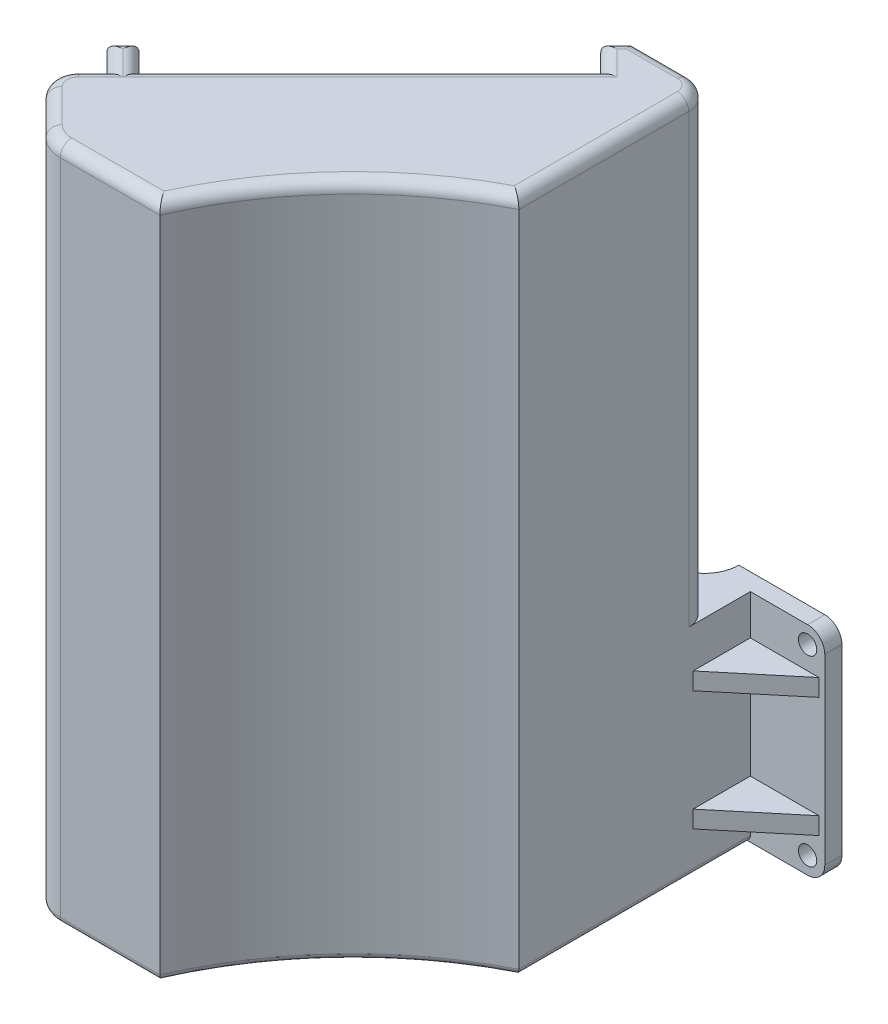
from build123d import *

# Parameters (mm, degrees)
SKETCH_2_R                                   = 1.5000000000000047
SKETCH_2_R_2                                 = 6
SKETCH_2_R_3                                 = 5.999999999999896
SKETCH_2_R_4                                 = 2.5000000000000044
SKETCH_2_R_5                                 = 6.0000000000000036
SKETCH_2_R_6                                 = 1.499999999999982
SKETCH_2_R_7                                 = 2.5000000000000475
SKETCH_2_R_8                                 = 5.999999999999912
SKETCH_2_R_9                                 = 6.000000000000018
SKETCH_2_R_10                                = 1.4999999999999887
SKETCH_2_R_11                                = 64.99999999999996
SKETCH_2_R_12                                = 2.5000000000000226
SKETCH_2_R_13                                = 5.999999999999982
SKETCH_2_R_14                                = 1.500000000000318
SKETCH_2_R_15                                = 2.500000000000045
SKETCH_2_R_16                                = 2.499999999999998
EXTRUDE_1_DEPTH                              = 3
CUT_EXTRUDE_1_DEPTH                          = 10
SKETCH_4_W                                   = 371.78166000996697
SKETCH_4_H                                   = 92.77079077614133
CUT_EXTRUDE_2_DEPTH                          = 10
CUT_EXTRUDE_3_DEPTH                          = 10
CUT_EXTRUDE_4_DEPTH                          = 10
MIRROR_3_COPY_1_DEPTH                        = 10
MIRROR_3_COPY_2_DEPTH                        = 10
SKETCH_13_R                                  = 1.4999999999999973
SKETCH_13_R_2                                = 1.5000000000000242
SKETCH_13_R_3                                = 1.499999999999971
CUT_EXTRUDE_7_DEPTH                          = 10
MIRROR_4_AT_THE_SECOND_PLANE_COPY_1_SKET_R   = 1.4999999999999973
MIRROR_4_AT_THE_SECOND_PLANE_COPY_1_SKET_R_2 = 1.5000000000000242
MIRROR_4_AT_THE_SECOND_PLANE_COPY_1_SKET_R_3 = 1.499999999999971
MIRROR_4_AT_THE_SECOND_PLANE_COPY_1_DEPTH    = 10
CUT_EXTRUDE_8_DEPTH                          = 10
FILLET_1_R                                   = 10
CUT_EXTRUDE_9_DEPTH                          = 10
FILLET_3_R                                   = 3
MIRROR_START                                 = -3
MIRROR_7_DEPTH                               = 3
FILLET_4_R                                   = 10
SKETCH_27_R                                  = 6.000000000000017
SKETCH_27_R_2                                = 6.00000000000001
EXTRUDE_2_DEPTH                              = 3
CUT_EXTRUDE_10_DEPTH                         = 3
MIRROR_11_COPY_1_DEPTH                       = 3
FILLET_5_R                                   = 8
SKETCH_30_R                                  = 4.999999999999998
CUT_EXTRUDE_11_DEPTH                         = 3
CUT_EXTRUDE_12_DEPTH                         = 3
FILLET_6_R                                   = 3
CUT_EXTRUDE_13_DEPTH                         = 3
FILLET_7_R                                   = 5
CUT_EXTRUDE_15_DEPTH                         = 10
PATTERN_CIRCULAR_1_COUNT                     = 6
CUT_EXTRUDE_16_DEPTH                         = 3
FILLET_8_R                                   = 8
SKETCH_35_R                                  = 1.6000000000000383
SKETCH_35_R_2                                = 1.6000000000000316
SKETCH_35_R_3                                = 1.549999999999985
SKETCH_35_R_4                                = 1.5499999999999818
CUT_EXTRUDE_17_DEPTH                         = 3
EXTRUDE_6_DEPTH                              = 37.9
EXTRUDE_7_DEPTH                              = 80
CUT_EXTRUDE_18_DEPTH                         = 75
SKETCH_49_W                                  = 56.99999999999994
SKETCH_49_H                                  = 2
CUT_EXTRUDE_24_DEPTH                         = 6
CUT_EXTRUDE_25_DEPTH                         = 77
CUT_EXTRUDE_26_DEPTH                         = 659.0034997067874
EXTRUDE_8_DEPTH                              = 1
EXTRUDE_9_DEPTH                              = 1
SKETCH_54_W                                  = 12.999999999999993
SKETCH_54_H                                  = 3
EXTRUDE_10_DEPTH                             = 37.9
SKETCH_55_R                                  = 1.5999999999999999
SKETCH_55_R_2                                = 1.6
SKETCH_55_R_3                                = 1.5999999999999974
SKETCH_55_R_4                                = 1.599999999999998
CUT_EXTRUDE_27_DEPTH                         = 3
CHAMFER_1_SIZE                               = 6
SKETCH_56_W                                  = 56.99999999999994
SKETCH_56_H                                  = 1.8999999999999986
CUT_EXTRUDE_28_DEPTH                         = 6
CUT_EXTRUDE_29_REACH                         = 643.105
RIB_24_DEPTH                                 = 3
RIB_25_DEPTH                                 = 3
SKETCH_62_W                                  = 19.88274623538981
SKETCH_62_H                                  = 7
CUT_EXTRUDE_30_DEPTH                         = 642.1048869249186
SKETCH_64_R                                  = 1.6000000000014152
SKETCH_64_R_2                                = 1.6000000000000214
SKETCH_64_R_3                                = 1.600000000005825
SKETCH_64_R_4                                = 1.6000000000029233
CUT_EXTRUDE_31_DEPTH                         = 10
FILLET_9_R                                   = 2
FILLET_10_R                                  = 1
FILLET_11_R                                  = 3
FILLET_12_R                                  = 4
FILLET_13_R                                  = 6
CUT_EXTRUDE_32_DEPTH                         = 629.3057907872907
CUT_EXTRUDE_33_DEPTH                         = 629.0418590638866


# Read off the part's stored shape, not the designer's step: 镜向7, 凸台-拉伸6, 分割2, 筋24, 筋25
# Some blends are built 0.0001 mm under size
with BuildPart() as part:
    # 草图2 → 凸台-拉伸1 (new body)
    with BuildSketch(Plane(origin=(0, 0, 0), x_dir=(1, 0, 0), z_dir=(0, 1, 0))):
        with BuildLine():
            Line((27.570452121331073, -570.9456738076426), (-65.28417146522384, -616.4870712236112))
            ThreePointArc((-65.28417146522382, -616.4870712236112), (-70.18356660465001, -620.9131675574213), (-72, -627.2609995659623))
            Line((-72, -627.2609995659623), (-71.9999999999999, -702.2609995659624))
            ThreePointArc((-72.00000000000003, -702.2609995659624), (-71.12457285451967, -706.7603193817217), (-68.62602019925255, -710.6031680803289))
            Line((-68.62602019925225, -710.6031680803286), (-4.16166117727812, -777.2609995659623))
            Line((-4.16166117727812, -777.2609995659623), (18.010224019904005, -777.2609995659623))
            ThreePointArc((18.010224019904005, -777.2609995659623), (25.57479680504481, -774.5764296997943), (29.75476556528185, -767.7238726623467))
            Line((29.75476556528182, -767.7238726623467), (35.41694496312394, -740.7230088042123))
            ThreePointArc((35.41694496312393, -740.7230088042123), (39.11913002337672, -734.3395076023972), (45.85666051961371, -731.3293673023098))
            Line((45.85666051961371, -731.3293673023098), (59.62894300052795, -729.8413226083014))
            ThreePointArc((59.62894300052794, -729.8413226083014), (64.99999999999996, -729.5520030171261), (70.37105699947203, -729.8413226083003))
            Line((70.37105699947203, -729.8413226083003), (84.14333948038299, -731.3293673023052))
            ThreePointArc((84.14333948038299, -731.3293673023052), (90.88747654966255, -734.3454566177528), (94.586801163437, -740.7403903132582))
            Line((94.58680116343702, -740.7403903132582), (100.24523443471817, -767.7238726623467))
            ThreePointArc((100.24523443471813, -767.7238726623467), (104.42520319495517, -774.5764296997943), (111.98977598009597, -777.2609995659623))
            Line((111.98977598009598, -777.2609995659623), (134.16166117727812, -777.2609995659619))
            Line((134.16166117727812, -777.2609995659619), (198.6260201992523, -710.6031680803287))
            ThreePointArc((198.62602019925245, -710.6031680803288), (201.12457285451964, -706.7603193817217), (202.00000000000003, -702.2609995659623))
            Line((201.99999999999997, -702.2609995659623), (202, -627.2609995659622))
            ThreePointArc((202, -627.2609995659622), (200.18356660465003, -620.9131675574212), (195.28417146522386, -616.4870712236111))
            Line((195.28417146522384, -616.4870712236112), (102.42954787866894, -570.9456738076426))
            ThreePointArc((102.42954787866887, -570.9456738076428), (65.00000000000001, -562.2609995659624), (27.57045212133115, -570.9456738076427))
        make_face()
        with Locations(Location((-54.25000000000036, -712.220291709485, 0), (0, 0, 270))):
            Circle(SKETCH_2_R, mode=Mode.SUBTRACT)
        with Locations(Location((24.797056938561603, -748.8766871478217, 0), (0, 0, 270))):
            Circle(SKETCH_2_R_2, mode=Mode.SUBTRACT)
        with BuildLine():
            Line((20.591308188858598, -731.9896561446249), (20.591308188858626, -725.8641802360004))
            ThreePointArc((20.59130818885863, -725.8641802360004), (22.09130818885864, -724.3641802360004), (23.59130818885865, -725.8641802360004))
            Line((23.591308188858655, -725.8641802360004), (23.59130818885863, -731.9896561446249))
            ThreePointArc((23.591308188858623, -731.9896561446249), (22.091308188858612, -733.4896561446249), (20.5913081888586, -731.9896561446249))
        make_face(mode=Mode.SUBTRACT)
        with Locations(Location((-59.99999999999989, -702.2609995659623, 0), (0, 0, 270))):
            Circle(SKETCH_2_R_3, mode=Mode.SUBTRACT)
        with Locations(Location((-0.08180909439592376, -684.8359995659603, 0), (0, 0, 270))):
            Circle(SKETCH_2_R_4, mode=Mode.SUBTRACT)
        with Locations(Location((105.20294306143838, -748.8766871478217, 0), (0, 0, 270))):
            Circle(SKETCH_2_R_5, mode=Mode.SUBTRACT)
        with BuildLine():
            ThreePointArc((64.99999999999959, -724.910999565959), (62.50000000000184, -722.410999565959), (64.99999999999959, -719.910999565959))
            ThreePointArc((64.99999999999959, -719.910999565959), (67.50000000000183, -722.410999565959), (64.99999999999959, -724.910999565959))
        make_face(mode=Mode.SUBTRACT)
        with BuildLine():
            ThreePointArc((106.4086918111405, -725.8641802360006), (107.90869181114051, -724.3641802360006), (109.40869181114053, -725.8641802360006))
            Line((109.40869181114053, -725.8641802360006), (109.40869181114053, -731.9896561446251))
            ThreePointArc((109.40869181114053, -731.9896561446251), (107.90869181114051, -733.4896561446251), (106.4086918111405, -731.9896561446251))
            Line((106.4086918111405, -731.9896561446251), (106.4086918111405, -725.8641802360006))
        make_face(mode=Mode.SUBTRACT)
        with Locations(Location((184.25000000000006, -712.2202917094831, 0), (0, 0, 270))):
            Circle(SKETCH_2_R_6, mode=Mode.SUBTRACT)
        with Locations(Location((130.08180909439972, -684.8359995659607, 0), (0, 0, 270))):
            Circle(SKETCH_2_R_7, mode=Mode.SUBTRACT)
        with Locations(Location((190.00000000000009, -702.2609995659622, 0), (0, 0, 270))):
            Circle(SKETCH_2_R_8, mode=Mode.SUBTRACT)
        with Locations(Location((-60.00000000000002, -627.2609995659623, 0), (0, 0, 270))):
            Circle(SKETCH_2_R_9, mode=Mode.SUBTRACT)
        with Locations(Location((-54.25000000000025, -617.3017074224413, 0), (0, 0, 270))):
            Circle(SKETCH_2_R_10, mode=Mode.SUBTRACT)
        with Locations(Location((64.99999999999989, -647.2609995659623, 0), (0, 0, 270))):
            Circle(SKETCH_2_R_11, mode=Mode.SUBTRACT)
        with Locations(Location((-0.08180909439525763, -609.6859995659634, 0), (0, 0, 270))):
            Circle(SKETCH_2_R_12, mode=Mode.SUBTRACT)
        with Locations(Location((190, -627.2609995659622, 0), (0, 0, 270))):
            Circle(SKETCH_2_R_13, mode=Mode.SUBTRACT)
        with Locations(Location((184.24999999999972, -617.3017074224396, 0), (0, 0, 270))):
            Circle(SKETCH_2_R_14, mode=Mode.SUBTRACT)
        with Locations(Location((130.0818090943998, -609.6859995659638, 0), (0, 0, 270))):
            Circle(SKETCH_2_R_15, mode=Mode.SUBTRACT)
        with Locations(Location((65.00000000000186, -572.1109995659656, 0), (0, 0, 270))):
            Circle(SKETCH_2_R_16, mode=Mode.SUBTRACT)
    extrude(amount=-EXTRUDE_1_DEPTH)

    # 草图3 → 切除-拉伸1 (cut)
    with BuildSketch(Plane(origin=(0, 0, 0), x_dir=(1, 0, 0), z_dir=(0, 1, 0))):
        with BuildLine():
            Line((121.51587319696436, -588.5355746177765), (85.94730895889907, -570.7191997782256))
            ThreePointArc((85.94730895889907, -570.7191997782256), (80.54189952091942, -572.5166702591793), (82.33937000187323, -577.9220796971589))
            Line((82.33937000187323, -577.9220796971589), (117.9079342399384, -595.7384545367102))
            ThreePointArc((117.9079342399384, -595.7384545367102), (123.31334367791833, -593.9409840557564), (121.51587319696434, -588.5355746177765))
        make_face()
        with BuildLine():
            ThreePointArc((138.46956923157344, -635.8035025633624), (139.84870390474788, -637.420135509176), (141.95274629343433, -637.7176588777585))
            Line((141.95274629343433, -637.7176588777585), (165.13379699493842, -632.4963328206468))
            ThreePointArc((165.13379699493842, -632.4963328206468), (166.22046082639363, -631.2568162732434), (165.37414925896013, -629.8422505148893))
            Line((165.37414925896013, -629.8422505148893), (135.31533670563007, -617.056624430874))
            ThreePointArc((135.31533670563007, -617.056624430874), (133.15982087484545, -617.4424933060375), (132.64985828721544, -619.5720663723587))
            Line((132.64985828721547, -619.5720663723587), (138.46956923157344, -635.8035025633624))
        make_face()
        with BuildLine():
            ThreePointArc((47.66062999812662, -577.9220796971589), (49.458100479080436, -572.5166702591793), (44.05269104110079, -570.7191997782256))
            Line((44.05269104110079, -570.7191997782256), (8.484126803035508, -588.5355746177765))
            ThreePointArc((8.484126803035533, -588.5355746177765), (6.686656322081563, -593.9409840557564), (12.09206576006148, -595.7384545367102))
            Line((12.092065760061473, -595.7384545367102), (47.66062999812663, -577.9220796971589))
        make_face()
        with BuildLine():
            Line((-8.46956923157338, -635.8035025633624), (-2.6498582872153955, -619.5720663723587))
            ThreePointArc((-2.649858287215366, -619.5720663723587), (-3.159820874845382, -617.4424933060375), (-5.315336705629993, -617.056624430874))
            Line((-5.315336705630003, -617.056624430874), (-35.37414925896007, -629.8422505148893))
            ThreePointArc((-35.37414925896005, -629.8422505148893), (-36.22046082639354, -631.2568162732434), (-35.13379699493835, -632.4963328206468))
            Line((-35.13379699493835, -632.4963328206468), (-11.952746293434263, -637.7176588777585))
            ThreePointArc((-11.952746293434268, -637.7176588777585), (-9.848703904747815, -637.420135509176), (-8.469569231573422, -635.8035025633624))
        make_face()
        with BuildLine():
            Line((-60.00000000000017, -681.4698265555824), (-60.00000000000018, -648.0521725763422))
            ThreePointArc((-60.00000000000017, -648.0521725763422), (-60.5521155693756, -645.1317244073003), (-62.132254377015116, -642.614382464179))
            Line((-62.13225437701511, -642.614382464179), (-68.80161843447775, -635.4176847342065))
            ThreePointArc((-68.80161843447776, -635.4176847342065), (-71.17182664593699, -631.6416718195246), (-72.00000000000006, -627.2609995659619))
            Line((-72.00000000000001, -627.2609995659619), (-72.00000000000006, -702.2609995659623))
            ThreePointArc((-72.00000000000006, -702.2609995659619), (-71.17182664593706, -697.8803273123995), (-68.80161843447806, -694.1043143977175))
            Line((-68.80161843447775, -694.1043143977179), (-62.13225437701511, -686.9076166677455))
            ThreePointArc((-62.132254377015116, -686.9076166677455), (-60.5521155693756, -684.3902747246242), (-60.00000000000017, -681.4698265555824))
        make_face()
        with BuildLine():
            ThreePointArc((201.9999999999999, -627.2609995659619), (201.17182664593682, -631.6416718195246), (198.8016184344776, -635.4176847342065))
            Line((198.80161843447763, -635.4176847342065), (192.13225437701496, -642.614382464179))
            ThreePointArc((192.13225437701496, -642.614382464179), (190.55211556937545, -645.1317244073003), (190.00000000000003, -648.0521725763422))
            Line((190.00000000000003, -648.0521725763422), (190.00000000000003, -681.4698265555824))
            ThreePointArc((190.00000000000003, -681.4698265555824), (190.55211556937545, -684.3902747246242), (192.13225437701496, -686.9076166677455))
            Line((192.13225437701496, -686.9076166677455), (198.80161843447763, -694.1043143977179))
            ThreePointArc((198.80161843447792, -694.1043143977176), (201.1718266459369, -697.8803273123995), (201.9999999999999, -702.2609995659619))
            Line((201.99999999999994, -702.2609995659623), (201.99999999999991, -627.2609995659619))
        make_face()
    extrude(amount=-CUT_EXTRUDE_1_DEPTH, mode=Mode.SUBTRACT)

    # 草图4 → 切除-拉伸2 (cut)
    with BuildSketch(Plane.XZ.offset(3)):
        with Locations((77.21480329684468, 600.8756041778915)):
            Rectangle(SKETCH_4_W, SKETCH_4_H)
    extrude(amount=-CUT_EXTRUDE_2_DEPTH, mode=Mode.SUBTRACT)

    # 镜向1: part across plane


with BuildPart() as part_1:
    add(part.part)
    add(part.part.mirror(Plane(origin=(-108.6760267081388, 7, 647.2609995659623), x_dir=(1, 0, 0), z_dir=(0, 0, 1))))

    # 草图5 → 切除-拉伸3 (cut)
    with BuildSketch(Plane(origin=(0, 0, 0), x_dir=(1, 0, 0), z_dir=(0, 1, 0))):
        Polygon((110.75315266269604, -552.5678534842502), (156.71509343982163, -598.5297942613757), (153.88666631507553, -601.358221386122), (107.92472553794985, -555.3962806089963), align=None)
    cut_extrude_3 = extrude(amount=-CUT_EXTRUDE_3_DEPTH, mode=Mode.SUBTRACT)

    # 草图6 → 切除-拉伸4 (cut)
    with BuildSketch(Plane(origin=(0, 0, 0), x_dir=(1, 0, 0), z_dir=(0, 1, 0))):
        with BuildLine():
            Line((107.92472553794983, -555.3962806089963), (110.75315266269611, -552.5678534842503))
            ThreePointArc((110.75315266269611, -552.5678534842503), (112.87447300625564, -552.5678534842502), (112.87447300625566, -554.6891738278098))
            Line((112.87447300625566, -554.6891738278098), (110.04604588150958, -557.5176009525561))
            ThreePointArc((110.04604588150958, -557.5176009525561), (107.92472553794983, -557.5176009525561), (107.92472553794983, -555.3962806089963))
        make_face()
        with BuildLine():
            Line((151.7653459715158, -599.2369010425623), (154.59377309626197, -596.4084739178161))
            ThreePointArc((154.59377309626197, -596.4084739178161), (156.71509343982166, -596.408473917816), (156.71509343982166, -598.5297942613757))
            Line((156.71509343982166, -598.5297942613757), (153.88666631507536, -601.3582213861218))
            ThreePointArc((153.88666631507536, -601.3582213861218), (151.76534597151579, -601.3582213861218), (151.7653459715158, -599.2369010425623))
        make_face()
    cut_extrude_4 = extrude(amount=-CUT_EXTRUDE_4_DEPTH, mode=Mode.SUBTRACT)

    # 镜向2: 切除-拉伸3, 切除-拉伸4 across plane
    add(cut_extrude_3.mirror(Plane.ZY.offset(-65.00000000000097)), mode=Mode.SUBTRACT)
    add(cut_extrude_4.mirror(Plane.ZY.offset(-65.00000000000097)), mode=Mode.SUBTRACT)

    # 镜向3: 切除-拉伸3, 切除-拉伸4 across plane
    add(cut_extrude_3.mirror(Plane(origin=(0, 0, 647.2609995659623), x_dir=(1, 0, 0), z_dir=(0, 0, -1))), mode=Mode.SUBTRACT)
    add(cut_extrude_4.mirror(Plane(origin=(0, 0, 647.2609995659623), x_dir=(1, 0, 0), z_dir=(0, 0, -1))), mode=Mode.SUBTRACT)

    # 镜向3 copy 1 sketch → 镜向3 copy 1 (cut)
    with BuildSketch(Plane(origin=(130.00000000000193, 0, 1294.5219991319245), x_dir=(-1, 0, 1.48e-15), z_dir=(0, 1, 0))):
        Polygon((110.75315266269604, -552.5678534842502), (156.71509343982163, -598.5297942613757), (153.88666631507553, -601.358221386122), (107.92472553794985, -555.3962806089963), align=None)
    extrude(amount=-MIRROR_3_COPY_1_DEPTH, mode=Mode.SUBTRACT)

    # 镜向3 copy 2 sketch → 镜向3 copy 2 (cut)
    with BuildSketch(Plane(origin=(130.00000000000193, 0, 1294.5219991319245), x_dir=(-1, 0, 1.48e-15), z_dir=(0, 1, 0))):
        with BuildLine():
            Line((107.92472553794983, -555.3962806089963), (110.75315266269611, -552.5678534842503))
            ThreePointArc((110.75315266269611, -552.5678534842503), (112.87447300625564, -552.5678534842502), (112.87447300625566, -554.6891738278098))
            Line((112.87447300625566, -554.6891738278098), (110.04604588150958, -557.5176009525561))
            ThreePointArc((110.04604588150958, -557.5176009525561), (107.92472553794983, -557.5176009525561), (107.92472553794983, -555.3962806089963))
        make_face()
        with BuildLine():
            Line((151.7653459715158, -599.2369010425623), (154.59377309626197, -596.4084739178161))
            ThreePointArc((154.59377309626197, -596.4084739178161), (156.71509343982166, -596.408473917816), (156.71509343982166, -598.5297942613757))
            Line((156.71509343982166, -598.5297942613757), (153.88666631507536, -601.3582213861218))
            ThreePointArc((153.88666631507536, -601.3582213861218), (151.76534597151579, -601.3582213861218), (151.7653459715158, -599.2369010425623))
        make_face()
    extrude(amount=-MIRROR_3_COPY_2_DEPTH, mode=Mode.SUBTRACT)

    # 草图13 → 切除-拉伸7 (cut)
    with BuildSketch(Plane.XZ.offset(3)):
        with Locations(Location((113.6169351265015, 566.6746337689215, 0), (0, 0, 270))):
            Circle(SKETCH_13_R)
        with Locations(Location((119.2737893759939, 572.3314880184138, 0), (0, 0, 270))):
            Circle(SKETCH_13_R_2)
        with Locations(Location((136.9514589056573, 590.0091575480784, 0), (0, 0, 270))):
            Circle(SKETCH_13_R_3)
        with Locations(Location((142.6083131551497, 595.6660117975707, 0), (0, 0, 270))):
            Circle(SKETCH_13_R_2)
    cut_extrude_7 = extrude(amount=-CUT_EXTRUDE_7_DEPTH, mode=Mode.SUBTRACT)

    # 镜向4: 切除-拉伸7 across plane
    add(cut_extrude_7.mirror(Plane(origin=(0, 0, 647.2609995659623), x_dir=(1, 0, 0), z_dir=(0, 0, -1))), mode=Mode.SUBTRACT)

    # 镜向4 at the second plane: 切除-拉伸7 across plane
    add(cut_extrude_7.mirror(Plane.ZY.offset(-65.00000000000097)), mode=Mode.SUBTRACT)

    # 镜向4 at the second plane copy 1 sket → 镜向4 at the second plane copy 1 (cut)
    with BuildSketch(Plane(origin=(130.00000000000003, -3, 1294.5219991319245), x_dir=(-1, 0, -1.48e-15), z_dir=(0, -1, 0))):
        with Locations(Location((113.6169351265015, 566.6746337689215, 0), (0, 0, 270))):
            Circle(MIRROR_4_AT_THE_SECOND_PLANE_COPY_1_SKET_R)
        with Locations(Location((119.2737893759939, 572.3314880184138, 0), (0, 0, 270))):
            Circle(MIRROR_4_AT_THE_SECOND_PLANE_COPY_1_SKET_R_2)
        with Locations(Location((136.9514589056573, 590.0091575480784, 0), (0, 0, 270))):
            Circle(MIRROR_4_AT_THE_SECOND_PLANE_COPY_1_SKET_R_3)
        with Locations(Location((142.6083131551497, 595.6660117975707, 0), (0, 0, 270))):
            Circle(MIRROR_4_AT_THE_SECOND_PLANE_COPY_1_SKET_R_2)
    extrude(amount=-MIRROR_4_AT_THE_SECOND_PLANE_COPY_1_DEPTH, mode=Mode.SUBTRACT)

    # 草图16 → 切除-拉伸8 (cut)
    with BuildSketch(Plane(origin=(0, 0, 0), x_dir=(1, 0, 0), z_dir=(0, 1, 0))):
        Polygon((127.37692123715716, -517.2609995659625), (169.2568005329661, -553.5502905886009), (134.16166117727812, -517.2609995659625), align=None)
    extrude(amount=-CUT_EXTRUDE_8_DEPTH, mode=Mode.SUBTRACT)

    # 圆角1
    # the kernel refuses this fillet: 10 mm, written as the material it takes off along each edge
    with BuildSketch(Plane(origin=(127.37692123715716, 9.324550733953913, 517.2609995659625), x_dir=(-1, 0, 0), z_dir=(0, -1, 0))) as fillet_1_piece_1:
        with BuildLine():
            CenterArc((FILLET_1_R * 0.372982029358, -FILLET_1_R), FILLET_1_R, 90.00000000000091, 40.909222995405685)
            Line((-FILLET_1_R * 0.281880446846, -FILLET_1_R * 0.244251935325), (0, 0))
            Line((0, 0), (FILLET_1_R * 0.372982029358, 0))
        make_face()
    extrude(amount=21.649101467907826, mode=Mode.SUBTRACT)
    with BuildSketch(Plane(origin=(169.25680053296594, 1.1022687939195022, 553.5502905886008), x_dir=(-0.755748064674862, 0, -0.6548624762041267), z_dir=(0, -1, 0))) as fillet_1_piece_2:
        with BuildLine():
            CenterArc((FILLET_1_R * 0.0440907517567, -FILLET_1_R), FILLET_1_R, 89.99999999999841, 5.049157832005278)
            Line((-FILLET_1_R * 0.04391966001, -FILLET_1_R * 0.00388044521722), (0, 0))
            Line((0, 0), (FILLET_1_R * 0.0440907517568, 0))
        make_face()
    extrude(amount=5.204537587839004, mode=Mode.SUBTRACT)

    # 草图17 → 切除-拉伸9 (cut)
    with BuildSketch(Plane.XZ.offset(3)):
        Polygon((124.36371131433484, 549.0184209215018), (133.6081704152833, 540.0781641329812), (144.38827302772066, 569.7243409138117), align=None)
        Polygon((141.6960128318563, 535.984125248652), (162.65212058188465, 593.6151606229062), (180.6229959969937, 576.2356428846425), align=None)
    extrude(amount=-CUT_EXTRUDE_9_DEPTH, mode=Mode.SUBTRACT)

    # 圆角3
    fillet_3_edges = [part_1.edges().sort_by_distance(p)[0] for p in [
        (180.6229959969937, -1.5, 576.2356428846425),
        (141.6960128318563, -1.5, 535.984125248652),
        (162.65212058188465, -1.5, 593.6151606229062),
        (124.36371131433484, -1.5, 549.0184209215018),
        (144.38827302772066, -1.5, 569.7243409138117),
        (133.6081704152833, -1.5, 540.0781641329812),
    ]]
    fillet(fillet_3_edges, radius=FILLET_3_R)

    # 镜向7 outline → 镜向7 (cut)
    with BuildSketch(Plane(origin=(0, 0, 0), x_dir=(1, 0, 0), z_dir=(0, 1, 0)).offset(MIRROR_START)):
        with BuildLine():
            Line((-4.601377687, -559.60443543), (3.550746557, -551.174925971))
            ThreePointArc((3.550746557, -551.174925971), (4.393821833, -549.03920548), (3.479783636, -546.932878793))
            Line((3.479783636, -546.932878793), (-0.28369345, -543.29324437))
            ThreePointArc((-0.28369345, -543.29324437), (-3.043472165, -542.526496946), (-5.188625785, -544.424547555))
            Line((-5.188625785, -544.424547555), (-9.577272943, -556.493691436))
            ThreePointArc((-9.577272943, -556.493691436), (-8.348177122, -560.062702211), (-4.601377687, -559.60443543))
        make_face()
        with BuildLine():
            Line((-21.482908173, -546.104030733), (-48.537453868, -574.079137835))
            ThreePointArc((-48.537453868, -574.079137835), (-49.380529145, -576.214858326), (-48.466490947, -578.321185013))
            Line((-48.466490947, -578.321185013), (-35.976597547, -590.400080386))
            ThreePointArc((-35.976597547, -590.400080386), (-33.216818832, -591.16682781), (-31.071665212, -589.268777201))
            Line((-31.071665212, -589.268777201), (-16.507012916, -549.214774726))
            ThreePointArc((-16.507012916, -549.214774726), (-17.736108738, -545.645763952), (-21.482908173, -546.104030733))
        make_face()
        with BuildLine():
            Line((134.601377687, -734.917563702), (126.449253443, -743.347073161))
            ThreePointArc((126.449253443, -743.347073161), (125.606178167, -745.482793652), (126.520216364, -747.589120339))
            Line((126.520216364, -747.589120339), (130.28369345, -751.228754762))
            ThreePointArc((130.28369345, -751.228754762), (133.043472165, -751.995502186), (135.188625785, -750.097451577))
            Line((135.188625785, -750.097451577), (139.577272943, -738.028307696))
            ThreePointArc((139.577272943, -738.028307696), (138.348177122, -734.459296921), (134.601377687, -734.917563702))
        make_face()
        with BuildLine():
            Line((151.482908173, -748.417968399), (178.537453868, -720.442861297))
            ThreePointArc((178.537453868, -720.442861297), (179.380529145, -718.307140806), (178.466490947, -716.200814119))
            Line((178.466490947, -716.200814119), (165.976597547, -704.121918746))
            ThreePointArc((165.976597547, -704.121918746), (163.216818832, -703.355171322), (161.071665212, -705.253221931))
            Line((161.071665212, -705.253221931), (146.507012916, -745.307224406))
            ThreePointArc((146.507012916, -745.307224406), (147.736108738, -748.87623518), (151.482908173, -748.417968399))
        make_face()
        with BuildLine():
            ThreePointArc((3.479783636, -747.589120339), (4.393821833, -745.482793652), (3.550746557, -743.347073161))
            Line((3.550746557, -743.347073161), (-4.601377687, -734.917563702))
            ThreePointArc((-4.601377687, -734.917563702), (-8.348177122, -734.459296921), (-9.577272943, -738.028307696))
            Line((-9.577272943, -738.028307696), (-5.188625785, -750.097451577))
            ThreePointArc((-5.188625785, -750.097451577), (-3.043472165, -751.995502186), (-0.28369345, -751.228754762))
            Line((-0.28369345, -751.228754762), (3.479783636, -747.589120339))
        make_face()
        with BuildLine():
            ThreePointArc((-48.466490947, -716.200814119), (-49.380529145, -718.307140806), (-48.537453868, -720.442861297))
            Line((-48.537453868, -720.442861297), (-21.482908173, -748.417968399))
            ThreePointArc((-21.482908173, -748.417968399), (-17.736108738, -748.87623518), (-16.507012916, -745.307224406))
            Line((-16.507012916, -745.307224406), (-31.071665212, -705.253221931))
            ThreePointArc((-31.071665212, -705.253221931), (-33.216818832, -703.355171322), (-35.976597547, -704.121918746))
            Line((-35.976597547, -704.121918746), (-48.466490947, -716.200814119))
        make_face()
    extrude(amount=MIRROR_7_DEPTH, mode=Mode.SUBTRACT)

    # 圆角4
    fillet_4_edges = [part_1.edges().sort_by_distance(p)[0] for p in [
        (-4.16166117727812, -1.5, 517.2609995659623),
        (134.16166117727812, -1.5, 777.2609995659619),
        (-4.16166117727812, -1.5, 777.2609995659623),
    ]]
    fillet(fillet_4_edges, radius=FILLET_4_R)

    # 草图27 → 凸台-拉伸2 (add)
    with BuildSketch(Plane(origin=(0, 0, 0), x_dir=(1, 0, 0), z_dir=(0, 1, 0))):
        with Locations((190, -702.2609995659623)):
            Circle(SKETCH_27_R)
        with Locations((190, -592.2609995659624)):
            Circle(SKETCH_27_R)
        with Locations((-59.99999999999999, -702.2609995659624)):
            Circle(SKETCH_27_R_2)
        with Locations((-59.99999999999999, -592.2609995659623)):
            Circle(SKETCH_27_R_2)
    extrude(amount=-EXTRUDE_2_DEPTH)

    # 草图29 → 切除-拉伸10 (cut)
    with BuildSketch(Plane(origin=(0, 0, 0), x_dir=(1, 0, 0), z_dir=(0, 1, 0))):
        with BuildLine():
            Line((-18.603091658246857, -532.1938159937773), (30.886261291551747, -532.1938159937773))
            Line((30.886261291551747, -532.1938159937773), (29.75476556528181, -526.7981264695778))
            ThreePointArc((29.75476556528181, -526.7981264695778), (25.574796805044826, -519.9455694321302), (18.010224019904005, -517.2609995659623))
            Line((18.010224019904005, -517.2609995659623), (0.07880128529566229, -517.2609995659623))
            ThreePointArc((0.07880128529566229, -517.2609995659623), (-3.82516650702444, -518.054532519558), (-7.109548880747996, -520.3091924706569))
            Line((-7.109548880747996, -520.3091924706569), (-18.603091658246857, -532.1938159937773))
        make_face()
    cut_extrude_10 = extrude(amount=-CUT_EXTRUDE_10_DEPTH, mode=Mode.SUBTRACT)

    # 镜向10: 切除-拉伸10 across plane
    add(cut_extrude_10.mirror(Plane.ZY.offset(-65.00000000000097)), mode=Mode.SUBTRACT)

    # 镜向11: 切除-拉伸10 across plane
    add(cut_extrude_10.mirror(Plane(origin=(0, 0, 647.2609995659623), x_dir=(1, 0, 0), z_dir=(0, 0, -1))), mode=Mode.SUBTRACT)

    # 镜向11 copy 1 sketch → 镜向11 copy 1 (cut)
    with BuildSketch(Plane(origin=(130.00000000000193, 0, 1294.5219991319245), x_dir=(-1, 0, 1.48e-15), z_dir=(0, 1, 0))):
        with BuildLine():
            Line((-18.603091658246857, -532.1938159937773), (30.886261291551747, -532.1938159937773))
            Line((30.886261291551747, -532.1938159937773), (29.75476556528181, -526.7981264695778))
            ThreePointArc((29.75476556528181, -526.7981264695778), (25.574796805044826, -519.9455694321302), (18.010224019904005, -517.2609995659623))
            Line((18.010224019904005, -517.2609995659623), (0.07880128529566229, -517.2609995659623))
            ThreePointArc((0.07880128529566229, -517.2609995659623), (-3.82516650702444, -518.054532519558), (-7.109548880747996, -520.3091924706569))
            Line((-7.109548880747996, -520.3091924706569), (-18.603091658246857, -532.1938159937773))
        make_face()
    extrude(amount=-MIRROR_11_COPY_1_DEPTH, mode=Mode.SUBTRACT)

    # 圆角5
    fillet_5_edges = [part_1.edges().sort_by_distance(p)[0] for p in [
        (-18.603091658246857, -1.5, 532.1938159937773),
        (30.886261291551747, -1.5, 532.1938159937773),
        (144.61022979513444, -1.5, 532.1938159937774),
        (99.11375893684696, -1.5, 532.1938159937773),
        (99.11375893684698, -1.5, 762.3281831381473),
        (148.603091658248, -1.5, 762.3281831381472),
        (30.886261291551747, -1.5, 762.3281831381472),
        (-18.603091658246857, -1.5, 762.3281831381472),
    ]]
    fillet(fillet_5_edges, radius=FILLET_5_R)

    # 草图30 → 切除-拉伸11 (cut)
    with BuildSketch(Plane(origin=(0, 0, 0), x_dir=(1, 0, 0), z_dir=(0, 1, 0))):
        with Locations(Location((-40.00000000000009, -601.4698265555824, 0), (0, 0, 270))):
            Circle(SKETCH_30_R)
        with Locations(Location((-40.00000000000009, -691.4698265555824, 0), (0, 0, 270))):
            Circle(SKETCH_30_R)
    extrude(amount=-CUT_EXTRUDE_11_DEPTH, mode=Mode.SUBTRACT)

    # 草图31 → 切除-拉伸12 (cut)
    with BuildSketch(Plane(origin=(0, 0, 0), x_dir=(1, 0, 0), z_dir=(0, 1, 0))):
        with BuildLine():
            Line((-28.694443352442732, -622.2609995659623), (-28.694443352442725, -672.2609995659623))
            Line((-28.694443352442725, -672.2609995659623), (-12.295751474375429, -667.8854220793706))
            ThreePointArc((-12.295751474375429, -667.8854220793706), (-14.999999999999986, -647.2609995659623), (-12.295751474375434, -626.6365770525539))
            Line((-12.295751474375434, -626.6365770525539), (-28.694443352442732, -622.2609995659623))
        make_face()
        with BuildLine():
            Line((158.69444335244273, -622.2609995659623), (158.69444335244273, -672.2609995659623))
            Line((158.69444335244273, -672.2609995659623), (142.29575147437544, -667.8854220793706))
            ThreePointArc((142.29575147437544, -667.8854220793706), (145, -647.2609995659623), (142.29575147437546, -626.6365770525539))
            Line((142.29575147437546, -626.6365770525539), (158.69444335244273, -622.2609995659623))
        make_face()
    extrude(amount=-CUT_EXTRUDE_12_DEPTH, mode=Mode.SUBTRACT)

    # 圆角6
    fillet_6_edges = [part_1.edges().sort_by_distance(p)[0] for p in [
        (142.29575147437544, -1.5, 626.6365770525539),
        (158.69444335244273, -1.5, 622.2609995659623),
        (158.69444335244273, -1.5, 672.2609995659623),
        (142.29575147437544, -1.5, 667.8854220793706),
        (-28.694443352442732, -1.5, 622.2609995659623),
        (-12.295751474375436, -1.5, 626.6365770525539),
        (-12.295751474375432, -1.5, 667.8854220793706),
        (-28.694443352442725, -1.5, 672.2609995659623),
    ]]
    fillet(fillet_6_edges, radius=FILLET_6_R)

    # 草图32 → 切除-拉伸13 (cut)
    with BuildSketch(Plane(origin=(0, 0, 0), x_dir=(1, 0, 0), z_dir=(0, 1, 0))):
        with BuildLine():
            Line((-62.13225437701525, -607.6143824641791), (-48.00000000000009, -622.2609995659623))
            Line((-48.00000000000009, -622.2609995659623), (-48.00000000000009, -672.2609995659623))
            Line((-48.00000000000009, -672.2609995659623), (-62.13225437701525, -686.9076166677455))
            ThreePointArc((-62.13225437701525, -686.9076166677455), (-60.55211556937571, -684.3902747246242), (-60.000000000000064, -681.4698265555824))
            Line((-60.000000000000064, -681.4698265555824), (-60.00000000000009, -648.0521725763422))
            ThreePointArc((-60.00000000000009, -648.0521725763422), (-60.00981059059691, -647.656100358355), (-60.03921830046551, -647.2609995659623))
            ThreePointArc((-60.03921830046551, -647.2609995659623), (-60.00981059059701, -646.8658987735695), (-60.00000000000009, -646.4698265555824))
            Line((-60.00000000000009, -646.4698265555824), (-60.000000000000064, -613.0521725763423))
            ThreePointArc((-60.000000000000064, -613.0521725763423), (-60.55211556937549, -610.1317244073003), (-62.13225437701525, -607.6143824641791))
        make_face()
        with BuildLine():
            Line((192.13225437701524, -686.9076166677455), (178.0000000000001, -672.2609995659623))
            Line((178.0000000000001, -672.2609995659623), (178.0000000000001, -622.2609995659623))
            Line((178.0000000000001, -622.2609995659623), (192.13225437701524, -607.6143824641791))
            ThreePointArc((192.13225437701524, -607.6143824641791), (190.55211556937547, -610.1317244073003), (190.00000000000006, -613.0521725763423))
            Line((190.00000000000006, -613.0521725763423), (190.0000000000001, -646.4698265555824))
            ThreePointArc((190.0000000000001, -646.4698265555824), (190.00981059059703, -646.8658987735695), (190.0392183004655, -647.2609995659623))
            ThreePointArc((190.0392183004655, -647.2609995659623), (190.00981059059694, -647.656100358355), (190.0000000000001, -648.0521725763422))
            Line((190.0000000000001, -648.0521725763422), (190.00000000000006, -681.4698265555824))
            ThreePointArc((190.00000000000006, -681.4698265555824), (190.5521155693757, -684.3902747246242), (192.13225437701524, -686.9076166677455))
        make_face()
    extrude(amount=-CUT_EXTRUDE_13_DEPTH, mode=Mode.SUBTRACT)

    # 圆角7
    fillet_7_edges = [part_1.edges().sort_by_distance(p)[0] for p in [
        (-48.00000000000009, -1.5, 622.2609995659623),
        (-48.00000000000009, -1.5, 672.2609995659623),
        (178.0000000000001, -1.5, 672.2609995659623),
        (178.0000000000001, -1.5, 622.2609995659623),
    ]]
    fillet(fillet_7_edges, radius=FILLET_7_R)

    # 草图33 → 切除-拉伸15 (cut)
    with BuildSketch(Plane(origin=(0, 0, 0), x_dir=(1, 0, 0), z_dir=(0, 1, 0))):
        with BuildLine():
            ThreePointArc((68.0998003992035, -569.6728964992898), (65.0000000000019, -569.6109995659655), (61.900199600800285, -569.6728964992897))
            ThreePointArc((61.900199600800285, -569.6728964992897), (59.501992818202794, -572.2707040802902), (62.09980039920336, -574.6689108628875))
            ThreePointArc((62.09980039920336, -574.6689108628875), (65.00000000000178, -574.6109995659655), (67.90019960080018, -574.6689108628876))
            ThreePointArc((67.90019960080018, -574.6689108628876), (70.49800718180065, -572.2707040802904), (68.0998003992035, -569.6728964992898))
        make_face()
        with BuildLine():
            ThreePointArc((-569.6728964992902, -68.0998003992015), (-569.6109995659659, -64.99999999999989), (-569.6728964992901, -61.90019960079826))
            ThreePointArc((-569.6728964992901, -61.90019960079826), (-572.2707040802906, -59.501992818200875), (-574.6689108628879, -62.099800399201335))
            ThreePointArc((-574.6689108628879, -62.099800399201335), (-574.610999565966, -64.99999999999977), (-574.6689108628882, -67.90019960079819))
            ThreePointArc((-574.6689108628882, -67.90019960079819), (-572.2707040802907, -70.498007181799), (-569.6728964992902, -68.0998003992015))
        make_face()
        with BuildLine():
            ThreePointArc((-68.09980039920187, 569.6728964992923), (-65.00000000000027, 569.610999565968), (-61.900199600798665, 569.6728964992922))
            ThreePointArc((-61.900199600798665, 569.6728964992922), (-59.50199281820128, 572.2707040802926), (-62.09980039920175, 574.66891086289))
            ThreePointArc((-62.09980039920175, 574.66891086289), (-65.00000000000014, 574.610999565968), (-67.90019960079854, 574.6689108628901))
            ThreePointArc((-67.90019960079854, 574.6689108628901), (-70.49800718179914, 572.2707040802928), (-68.09980039920187, 569.6728964992923))
        make_face()
        with BuildLine():
            ThreePointArc((569.672896499292, 68.09980039920389), (569.6109995659679, 65.00000000000226), (569.6728964992918, 61.90019960080064))
            ThreePointArc((569.6728964992918, 61.90019960080064), (572.2707040802923, 59.50199281820325), (574.6689108628897, 62.09980039920372))
            ThreePointArc((574.6689108628897, 62.09980039920372), (574.6109995659676, 65.00000000000215), (574.6689108628898, 67.90019960080056))
            ThreePointArc((574.6689108628898, 67.90019960080056), (572.2707040802924, 70.49800718180126), (569.672896499292, 68.09980039920389))
        make_face()
    cut_extrude_15 = extrude(amount=-CUT_EXTRUDE_15_DEPTH, mode=Mode.SUBTRACT)

    # 阵列(圆周)1: 切除-拉伸15 ×6 about axis
    pattern_circular_1_axis = Axis((64.99999999999994, 0, 647.2609995659618), (0, 1, 0))
    for i in range(1, PATTERN_CIRCULAR_1_COUNT):
        add(cut_extrude_15.rotate(pattern_circular_1_axis, i * 360 / PATTERN_CIRCULAR_1_COUNT), mode=Mode.SUBTRACT)

    # 草图34 → 切除-拉伸16 (cut)
    with BuildSketch(Plane(origin=(0, 0, 0), x_dir=(1, 0, 0), z_dir=(0, 1, 0))):
        with BuildLine():
            Line((-68.62602019925248, -583.9188310515958), (-64.5, -579.6524183652564))
            Line((-64.5, -579.6524183652564), (-64.49999999999999, -605.0594237899679))
            Line((-64.49999999999999, -605.0594237899679), (-68.80161843447785, -600.4176847342067))
            ThreePointArc((-68.80161843447785, -600.4176847342067), (-71.99932040979917, -592.1332901184819), (-68.62602019925248, -583.9188310515958))
        make_face()
        with BuildLine():
            Line((-64.5, -714.8695807666682), (-64.49999999999999, -689.4625753419566))
            Line((-64.49999999999999, -689.4625753419566), (-68.80161843447785, -694.1043143977179))
            ThreePointArc((-68.80161843447785, -694.1043143977179), (-71.9993204097991, -702.3887090134426), (-68.62602019925248, -710.6031680803287))
            Line((-68.62602019925248, -710.6031680803287), (-64.5, -714.8695807666682))
        make_face()
        with BuildLine():
            Line((198.6260201992526, -710.6031680803286), (194.5000000000001, -714.869580766668))
            Line((194.5000000000001, -714.869580766668), (194.5000000000001, -689.4625753419566))
            Line((194.5000000000001, -689.4625753419566), (198.80161843447797, -694.1043143977179))
            ThreePointArc((198.80161843447797, -694.1043143977179), (201.99932040979914, -702.3887090134425), (198.6260201992526, -710.6031680803286))
        make_face()
        with BuildLine():
            Line((194.5000000000001, -579.6524183652565), (194.5000000000001, -605.0594237899679))
            Line((194.5000000000001, -605.0594237899679), (198.80161843447797, -600.4176847342067))
            ThreePointArc((198.80161843447797, -600.4176847342067), (201.9993204097992, -592.133290118482), (198.6260201992526, -583.9188310515959))
            Line((198.6260201992526, -583.9188310515959), (194.5000000000001, -579.6524183652565))
        make_face()
    extrude(amount=-CUT_EXTRUDE_16_DEPTH, mode=Mode.SUBTRACT)

    # 圆角8
    fillet_8_edges = [part_1.edges().sort_by_distance(p)[0] for p in [
        (194.5000000000001, -1.5, 579.6524183652565),
        (194.5000000000001, -1.5, 605.0594237899679),
        (194.5000000000001, -1.5, 714.869580766668),
        (194.5000000000001, -1.5, 689.4625753419566),
        (-64.5, -1.5, 714.8695807666682),
        (-64.49999999999999, -1.5, 689.4625753419566),
        (-64.5, -1.5, 579.6524183652564),
        (-64.49999999999999, -1.5, 605.0594237899679),
    ]]
    fillet(fillet_8_edges, radius=FILLET_8_R)

    # 草图35 → 切除-拉伸17 (cut)
    with BuildSketch(Plane(origin=(0, 0, 0), x_dir=(1, 0, 0), z_dir=(0, 1, 0))):
        with Locations(Location((-49.10769912250808, -588.4300629673916, 0), (0, 0, 270))):
            Circle(SKETCH_35_R)
        with Locations(Location((179.10769912250808, -588.4300629673916, 0), (0, 0, 270))):
            Circle(SKETCH_35_R_2)
        with Locations(Location((179.10769912250808, -706.0919361645331, 0), (0, 0, 270))):
            Circle(SKETCH_35_R_2)
        with Locations(Location((-49.10769912250808, -706.0919361645331, 0), (0, 0, 270))):
            Circle(SKETCH_35_R)
        with Locations(Location((169.00000000000009, -633.2609995659623, 0), (0, 0, 270))):
            Circle(SKETCH_35_R_3)
        with Locations(Location((169.00000000000009, -661.2609995659623, 0), (0, 0, 270))):
            Circle(SKETCH_35_R_3)
        with Locations(Location((-39.00000000000009, -661.2609995659623, 0), (0, 0, 270))):
            Circle(SKETCH_35_R_3)
        with Locations(Location((-39.00000000000009, -633.2609995659623, 0), (0, 0, 270))):
            Circle(SKETCH_35_R_3)
        with Locations(Location((-14.332218973856195, -753.4963202202799, 0), (0, 0, 270))):
            Circle(SKETCH_35_R_4)
        with Locations(Location((-14.332218973856195, -541.0256789116446, 0), (0, 0, 270))):
            Circle(SKETCH_35_R_4)
        with Locations(Location((144.33221897385621, -753.4963202202799, 0), (0, 0, 270))):
            Circle(SKETCH_35_R_3)
        with Locations(Location((144.33221897385621, -541.0256789116446, 0), (0, 0, 270))):
            Circle(SKETCH_35_R_3)
    extrude(amount=-CUT_EXTRUDE_17_DEPTH, mode=Mode.SUBTRACT)

    # 凸台-拉伸6 outline → 凸台-拉伸6 (add)
    with BuildSketch(Plane(origin=(0, 0, 0), x_dir=(1, 0, 0), z_dir=(0, 1, 0))):
        with BuildLine():
            Line((15.324305837, -548.645311984), (22.075274462, -555.396280609))
            Line((22.075274462, -555.396280609), (-34.493268033, -611.964823104))
            Line((-34.493268033, -611.964823104), (-0.093823606, -646.364267531))
            ThreePointArc((-0.093823606, -646.364267531), (9.833129721, -612.697631333), (35.797056939, -589.078544164))
            Line((35.797056939, -589.078544164), (35.797056939, -545.645311984))
            Line((35.797056939, -545.645311984), (30.797056939, -545.645311984))
            ThreePointArc((30.797056939, -545.645311984), (24.797056939, -551.645311984), (18.797056939, -545.645311984))
            Line((18.797056939, -545.645311984), (5.324305837, -545.645311984))
            Line((5.324305837, -545.645311984), (5.324305837, -548.645311984))
            Line((5.324305837, -548.645311984), (15.324305837, -548.645311984))
        make_face()
    extrude(amount=EXTRUDE_6_DEPTH)


with BuildPart() as body_2:
    # Split Bodies 2: the piece on the far side of the plane
    add(part_1.part)
    split(bisect_by=Plane(origin=(0, 0, 0), x_dir=(1, 0, 0), z_dir=(0, 1, 0)), keep=Keep.BOTTOM)


with BuildPart() as part_2:
    add(part_1.part)

    # Split Bodies 2
    split(bisect_by=Plane(origin=(0, 0, 0), x_dir=(1, 0, 0), z_dir=(0, 1, 0)), keep=Keep.TOP)

    # 草图39 → 凸台-拉伸7 (add)
    with BuildSketch(Plane(origin=(0, 37.9, 0), x_dir=(1, 0, 0), z_dir=(0, 1, 0))):
        with BuildLine():
            Line((22.07527446205121, -555.3962806089962), (35.79705693856161, -555.3962806089962))
            Line((35.79705693856161, -555.3962806089962), (35.79705693856157, -589.0785441644379))
            ThreePointArc((35.79705693856157, -589.0785441644379), (9.833129720944953, -612.6976313329051), (-0.09382360606104145, -646.3642675307315))
            Line((-0.09382360606104145, -646.3642675307315), (-34.493268032872614, -611.9648231039198))
            Line((-34.493268032872614, -611.9648231039198), (22.07527446205121, -555.3962806089962))
        make_face()
    extrude(amount=EXTRUDE_7_DEPTH)

    # 草图40 → 切除-拉伸18 (cut)
    with BuildSketch(Plane(origin=(0, 117.9, 0), x_dir=(1, 0, 0), z_dir=(0, 1, 0))):
        Polygon((-21.058239190328127, -598.5297942613756), (19.24684733730504, -558.2247077337424), (23.48948802442434, -562.4673484208618), (-16.815598503208868, -602.772434948495), align=None)
    extrude(amount=-CUT_EXTRUDE_18_DEPTH, mode=Mode.SUBTRACT)

    # 草图49 → 切除-拉伸24 (cut)
    with BuildSketch(Plane(origin=(288.7357775355238, 0, 288.7357775355253), x_dir=(-0.7071067811865495, 0, 0.7071067811865457), z_dir=(-0.7071067811865457, 0, -0.7071067811865495))):
        with Locations((409.6148999957361, 41.900000000000006)):
            Rectangle(SKETCH_49_W, SKETCH_49_H)
    extrude(amount=-CUT_EXTRUDE_24_DEPTH, mode=Mode.SUBTRACT)

    # 草图50 → 切除-拉伸25 (cut)
    with BuildSketch(Plane(origin=(0, 117.9, 0), x_dir=(1, 0, 0), z_dir=(0, 1, 0))):
        Polygon((-23.886666315074343, -601.3582213861218), (-34.493268032872614, -611.9648231039198), (-30.250627345753067, -616.2074637910393), (-19.644025627955134, -605.6008620732413), align=None)
    extrude(amount=-CUT_EXTRUDE_25_DEPTH, mode=Mode.SUBTRACT)

    # 草图51 → 切除-拉伸26 (cut, through all)
    with BuildSketch(Plane.XZ):
        with BuildLine():
            Line((-0.09382360606119411, 646.3642675307315), (-18.17955953388797, 628.2785316029046))
            Line((-18.179559533888, 628.2785316029046), (2.729012292790003, 628.2785316029046))
            ThreePointArc((2.7290122927900455, 628.2785316029046), (0.6787573873991448, 637.2216893919041), (-0.09382360606117857, 646.3642675307315))
        make_face()
    extrude(amount=-CUT_EXTRUDE_26_DEPTH, mode=Mode.SUBTRACT)

    # 草图52 → 凸台-拉伸8 (add)
    with BuildSketch(Plane(origin=(0, 40.900000000000006, 0), x_dir=(1, 0, 0), z_dir=(0, 1, 0))):
        Polygon((-19.644025627954935, -605.6008620732413), (-23.886666315074468, -601.3582213861217), (-34.49326803287245, -611.9648231039197), (-30.250627345752967, -616.2074637910393), align=None)
    extrude(amount=EXTRUDE_8_DEPTH)

    # 草图53 → 凸台-拉伸9 (add)
    with BuildSketch(Plane(origin=(0, 40.900000000000006, 0), x_dir=(1, 0, 0), z_dir=(0, 1, 0))):
        Polygon((19.246847337305194, -558.2247077337425), (23.489488024424382, -562.4673484208618), (-16.81559850320871, -602.7724349484948), (-21.05823919032792, -598.5297942613756), align=None)
    extrude(amount=EXTRUDE_9_DEPTH)

    # 草图54 → 凸台-拉伸10 (add)
    with BuildSketch(Plane(origin=(0, 0, 0), x_dir=(-1, 0, 0), z_dir=(0, -1, 0))):
        with Locations((-42.29705693856161, -547.1453119841028)):
            Rectangle(SKETCH_54_W, SKETCH_54_H)
    extrude(amount=-EXTRUDE_10_DEPTH)

    # 草图55 → 切除-拉伸27 (cut)
    with BuildSketch(Plane(origin=(0, 0, 545.6453119841028), x_dir=(-1, 0, 0), z_dir=(0, 0, -1))):
        with Locations((-8.324305837157237, 34.89999999999999)):
            Circle(SKETCH_55_R)
        with Locations((-8.324305837157237, 3)):
            Circle(SKETCH_55_R_2)
        with Locations((-45.79705693856159, 34.89999999999999)):
            Circle(SKETCH_55_R_3)
        with Locations((-45.79705693856159, 3.0000000000000027)):
            Circle(SKETCH_55_R_4)
    extrude(amount=-CUT_EXTRUDE_27_DEPTH, mode=Mode.SUBTRACT)

    # 倒角1
    chamfer_1_edges = [part_2.edges().sort_by_distance(p)[0] for p in [
        (22.075274462, 18.95, 555.396280609),
    ]]
    chamfer(chamfer_1_edges, length=CHAMFER_1_SIZE)

    # 草图56 → 切除-拉伸28 (cut)
    with BuildSketch(Plane(origin=(288.7357775355238, 0, 288.7357775355253), x_dir=(-0.7071067811865495, 0, 0.7071067811865457), z_dir=(-0.7071067811865457, 0, -0.7071067811865495))):
        with Locations((409.6148999957361, 40.95)):
            Rectangle(SKETCH_56_W, SKETCH_56_H)
    extrude(amount=-CUT_EXTRUDE_28_DEPTH, mode=Mode.SUBTRACT)

    # 切除-拉伸29: up to this face of the body (flat: up to its plane)
    cut_extrude_29_end = Plane(part_2.part.faces().sort_by_distance((7.041606521, 117.9, 595.786528322))[0])
    # 草图57 → 切除-拉伸29 (cut, up to the picked face)
    with BuildSketch(Plane.XZ, mode=Mode.PRIVATE) as cut_extrude_29_sk1:
        Polygon((-34.493268032872614, 611.9648231039199), (-6.208996785410759, 640.2490943513818), (-0.9056959265115297, 634.9457934924826), (-29.189967173973415, 606.6615222450207), align=None)
    cut_extrude_29_tool1 = split(extrude(cut_extrude_29_sk1.sketch, amount=-CUT_EXTRUDE_29_REACH, mode=Mode.PRIVATE), bisect_by=cut_extrude_29_end, keep=Keep.BOTH, mode=Mode.PRIVATE)
    add(cut_extrude_29_tool1.solids().sort_by(Axis((-17.699482, 0, 623.455308), (0, 1, 0)))[0], mode=Mode.SUBTRACT)

    # 筋24 outline → 筋24 (add)
    with BuildSketch(Plane(origin=(0, 10, 0), x_dir=(-1, 0, 0), z_dir=(0, -1, 0))):
        Polygon((-17.832633775, -551.153639922), (-17.832633775, -558.638921296), (-6.324305837, -548.645311984), (-15.324305837, -548.645311984), align=None)
    rib_24 = extrude(amount=RIB_24_DEPTH)

    # 筋25 outline → 筋25 (add)
    with BuildSketch(Plane(origin=(0, 10, 0), x_dir=(-1, 0, 0), z_dir=(0, -1, 0))):
        Polygon((-35.797056939, -548.645311984), (-47.797056939, -548.645311984), (-35.797056939, -558.638921296), align=None)
    rib_25 = extrude(amount=RIB_25_DEPTH)

    # 镜向12: 筋24, 筋25 across plane
    add(rib_24.mirror(Plane(origin=(0, 18.95, 0), x_dir=(0, 0, 1), z_dir=(0, -1, 0))))
    add(rib_25.mirror(Plane(origin=(0, 18.95, 0), x_dir=(0, 0, 1), z_dir=(0, -1, 0))))

    # 草图62 → 切除-拉伸30 (cut, through all)
    with BuildSketch(Plane(origin=(0, 117.9, 0), x_dir=(1, 0, 0), z_dir=(0, 1, 0))):
        with Locations((-4.631584698394476, -624.7785316029046)):
            Rectangle(SKETCH_62_W, SKETCH_62_H)
    extrude(amount=-CUT_EXTRUDE_30_DEPTH, mode=Mode.SUBTRACT)

    # 草图64 → 切除-拉伸31 (cut)
    with BuildSketch(Plane(origin=(292.97841822264314, 0, 292.97841822264314), x_dir=(-0.7071067811865475, 0, 0.7071067811865477), z_dir=(-0.7071067811865477, 0, -0.7071067811865475))):
        with Locations((415.63172272660825, 78.25483399576224)):
            Circle(SKETCH_64_R)
        with Locations((432.60228547480693, 61.28427124701973)):
            Circle(SKETCH_64_R_2)
        with Locations((404.3180142269163, 33.00000000000001)):
            Circle(SKETCH_64_R_3)
        with Locations((387.34745147870444, 49.970562748742296)):
            Circle(SKETCH_64_R_4)
    extrude(amount=-CUT_EXTRUDE_31_DEPTH, mode=Mode.SUBTRACT)

    # 圆角9
    fillet_9_edges = [part_2.edges().sort_by_distance(p)[0] for p in [
        (20.661060899678112, 117.9, 556.8104941713693),
        (35.79705693856159, 117.9, 572.2374123867171),
        (28.93616570030641, 117.9, 555.3962806089962),
        (-22.47245275270137, 117.9, 599.9440078237486),
        (-18.9369188467685, 117.9, 600.6511146049353),
        (3.336944760607736, 117.9, 582.6198916846784),
        (21.36816768086469, 117.9, 560.3460280773021),
        (-21.76534597151474, 117.9, 603.4795417296816),
        (-22.295676057404542, 117.9, 608.2525125026907),
        (-19.760142151471726, 117.9, 616.0913472675225),
        (17.727301395867826, 117.9, 602.5027381309727),
        (-4.631584698394477, 117.9, 621.2785316029046),
    ]]
    fillet(fillet_9_edges, radius=FILLET_9_R - 0.0001)  # a hair under: the kernel refuses the full size

    # 圆角10
    fillet_10_edges = [part_2.edges().sort_by_distance(p)[0] for p in [
        (17.72730139610797, 0, 602.5027381307568),
        (35.797056939, 0, 568.8619280740514),
        (17.83263377488068, 0, 555.3962806090016),
        (-5.678666699552121, 0, 583.1502217705643),
        (-21.881462495031432, 0, 613.9700269239627),
        (-4.631584698394477, 0, 621.2785316029046),
    ]]
    fillet(fillet_10_edges, radius=FILLET_10_R)

    # 圆角11
    fillet_11_edges = [part_2.edges().sort_by_distance(p)[0] for p in [
        (5.324305837, 37.9, 547.145311984),
        (5.324305837, 0, 547.145311984),
        (48.797056938561596, 0, 547.1453119841028),
        (48.797056938561596, 37.9, 547.1453119841028),
    ]]
    fillet(fillet_11_edges, radius=FILLET_11_R)

    # 圆角12
    # the kernel refuses this fillet: 4 mm, written as the material it takes off along each edge
    with BuildSketch(Plane(origin=(31.797056939, 117.9, 559.3962806089962), x_dir=(1, 0, 0), z_dir=(0, 0, 1))) as fillet_12_piece_1:
        with BuildLine():
            CenterArc((2.0000999999999998, -1.9999), 1.9999, 0, 90)
            Line((4, -1.9999), (4, 0))
            Line((4, 0), (2.0000999999999998, 0))
        make_face()
    revolve(axis=Axis((31.797056939, 117.9, 559.3962806089962), (0, 1, 0)), revolution_arc=90, mode=Mode.SUBTRACT)
    with BuildSketch(Plane(origin=(-19.29047223736156, 117.9, 610.9041629321401), x_dir=(-0.7071067811865521, 0, -0.7071067811865429), z_dir=(0.7071067811865429, 0, -0.7071067811865521))) as fillet_12_piece_2:
        with BuildLine():
            CenterArc((2.0000999999999998, -1.9999), 1.9999, 0, 90)
            Line((4, -1.9999), (4, 0))
            Line((4, 0), (2.0000999999999998, 0))
        make_face()
    revolve(axis=Axis((-19.29047223736156, 117.9, 610.9041629321401), (0, 1, 0)), revolution_arc=89.99999999999962, mode=Mode.SUBTRACT)
    with BuildSketch(Plane(origin=(-24.94732648685395, 117.9, 610.9041629321401), x_dir=(0.7071067811865422, 0, 0.7071067811865529), z_dir=(0, -1, 0))) as fillet_12_piece_3:
        with BuildLine():
            CenterArc((FILLET_12_R, -FILLET_12_R), FILLET_12_R, 89.99999999999925, 90.00000000000091)
            Line((-4.269e-14, -FILLET_12_R), (-FILLET_12_R * 0.02, -FILLET_12_R))
            Line((-FILLET_12_R * 0.02, -FILLET_12_R), (-FILLET_12_R * 0.02, FILLET_12_R * 0.02))
            Line((-FILLET_12_R * 0.02, FILLET_12_R * 0.02), (FILLET_12_R, FILLET_12_R * 0.02))
            Line((FILLET_12_R, FILLET_12_R * 0.02), (FILLET_12_R, -1.2e-16))
        make_face()
    extrude(amount=76, mode=Mode.SUBTRACT)
    with BuildSketch(Plane(origin=(35.79705693856161, 37.9, 555.3962806089962), x_dir=(1.0959766427731665e-10, 0, 1.0), z_dir=(0, 1, 0))) as fillet_12_piece_4:
        with BuildLine():
            CenterArc((FILLET_12_R, -FILLET_12_R), FILLET_12_R, 89.99999999372052, 89.99999999999999)
            Line((-FILLET_12_R * 1.09597664265e-10, -FILLET_12_R), (-FILLET_12_R * 0.0200000001096, -FILLET_12_R))
            Line((-FILLET_12_R * 0.0200000001096, -FILLET_12_R), (-FILLET_12_R * 0.0199999999978, FILLET_12_R * 0.0200000000022))
            Line((-FILLET_12_R * 0.0199999999978, FILLET_12_R * 0.0200000000022), (FILLET_12_R, FILLET_12_R * 0.02))
            Line((FILLET_12_R, FILLET_12_R * 0.02), (FILLET_12_R, 0))
        make_face()
    extrude(amount=80, mode=Mode.SUBTRACT)

    # 圆角13
    # the kernel refuses this fillet: 6 mm, written as the material it takes off along each edge
    with BuildSketch(Plane(origin=(-12.08767644185085, 117.9, 615.2785316029046), x_dir=(-0.7071067811865478, 0, 0.7071067811865474), z_dir=(-0.7071067811865474, 0, -0.7071067811865478))) as fillet_13_piece_1:
        with BuildLine():
            CenterArc((4.0001, -1.9999), 1.9999, 0, 90)
            Line((6, -1.9999), (6, 0))
            Line((6, 0), (4.0001, 0))
        make_face()
    revolve(axis=Axis((-12.08767644185085, 117.9, 615.2785316029046), (0, 1, 0)), revolution_arc=45.000000000000014, mode=Mode.SUBTRACT)
    with BuildSketch(Plane(origin=(-12.08767644185085, 0, 615.2785316029046), x_dir=(0, 0, 1), z_dir=(1, 0, 0))) as fillet_13_piece_2:
        with BuildLine():
            CenterArc((5, -1), 1, 0, 90)
            Line((6, -1), (6, 0))
            Line((6, 0), (5, 0))
        make_face()
    revolve(axis=Axis((-12.08767644185085, 0, 615.2785316029046), (0, -1, 0)), revolution_arc=45.000000000000014, mode=Mode.SUBTRACT)
    with BuildSketch(Plane(origin=(-14.572957816089529, 117.9, 621.2785316029046), x_dir=(-0.7071067811865379, 0, -0.7071067811865572), z_dir=(0, -1, 0))) as fillet_13_piece_3:
        with BuildLine():
            CenterArc((FILLET_13_R * 0.414213562373, FILLET_13_R), FILLET_13_R, 224.99999999999986, 44.999999999999034)
            Line((-FILLET_13_R * 0.292893218813, FILLET_13_R * 0.292893218813), (0, 0))
            Line((0, 0), (FILLET_13_R * 0.414213562373, -1.1e-16))
        make_face()
    extrude(amount=117.90000000000002, mode=Mode.SUBTRACT)

    # 草图65 → 切除-拉伸32 (cut, through all)
    with BuildSketch(Plane(origin=(0, 37.9, 0), x_dir=(1, 0, 0), z_dir=(0, 1, 0))):
        Polygon((17.832633774931903, -559.6389212961157), (22.07527446205121, -555.3962806089962), (15.324305837157326, -548.6453119841028), (5.3243058371573255, -548.6453119841028), align=None)
    extrude(amount=-CUT_EXTRUDE_32_DEPTH, mode=Mode.SUBTRACT)

    # 草图66 → 切除-拉伸33 (cut, through all)
    with BuildSketch(Plane(origin=(0, 40.00000000000001, 0), x_dir=(1, 0, 0), z_dir=(0, 1, 0))):
        Polygon((19.24684733730504, -558.2247077337424), (23.489488024424396, -562.4673484208618), (-16.607417634255565, -602.5642540795419), (-20.850058321374963, -598.3216133924226), align=None)
    extrude(amount=-CUT_EXTRUDE_33_DEPTH, mode=Mode.SUBTRACT)


solid = part_2.part
